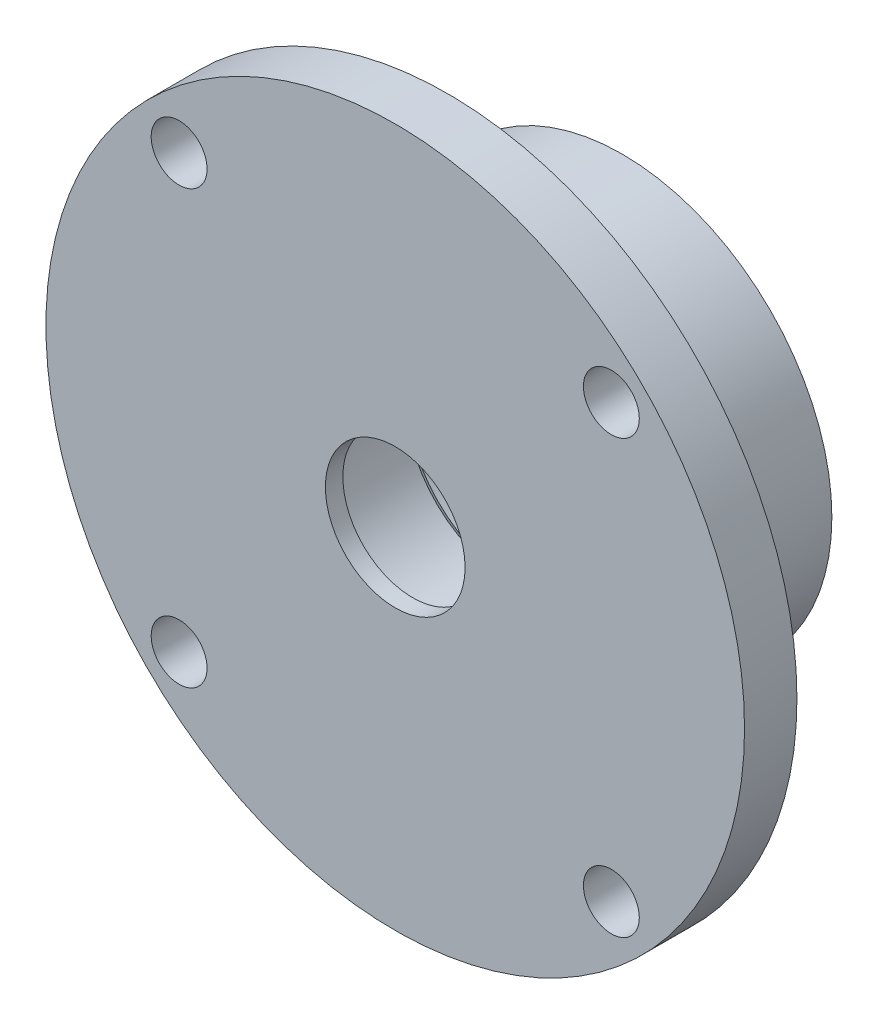
from build123d import *

# Parameters (mm, degrees)
CHAMFER_1_SIZE           = 0.4
CUT_EXTRUDE_1_REACH      = 33.129
SKETCH_2_R               = 1.6
PATTERN_CIRCULAR_1_COUNT = 4


with BuildPart() as part:
    # Эскиз1 → Повернуть1 (revolve)
    with BuildSketch(Plane(origin=(0, 0, 0), x_dir=(1, 0, 0), z_dir=(0, 1, 0))):
        Polygon((-4, 0), (-20, 0), (-20, 3), (-12, 3), (-12, 13), (-9.5, 13), (-9.5, 7), (-6, 7), (-6, 1), (-4, 1), align=None)
    revolve(axis=Axis((0, 0, 0), (0, 0, -1)))

    # Фаска1
    chamfer_1_edges = [part.edges().sort_by_distance(p)[0] for p in [
        (6, 0, -7),
    ]]
    chamfer(chamfer_1_edges, length=CHAMFER_1_SIZE)

    # Эскиз2 → Вырез-Вытянуть1 (cut, up to next)
    with BuildSketch(Plane.XY, mode=Mode.PRIVATE) as cut_extrude_1_sk1:
        with Locations((12.374368671, 12.374368671)):
            Circle(SKETCH_2_R)
    cut_extrude_1_tool1 = extrude(cut_extrude_1_sk1.sketch, amount=-CUT_EXTRUDE_1_REACH, mode=Mode.PRIVATE) & part.part
    cut_extrude_1 = cut_extrude_1_tool1.solids().sort_by_distance((12.374369, 12.374369, 0))[0]
    add(cut_extrude_1, mode=Mode.SUBTRACT)

    # Круговой массив1: Вырез-Вытянуть1 ×4 about axis
    pattern_circular_1_axis = Axis((0, 0, 0), (0, 0, 1))
    for i in range(1, PATTERN_CIRCULAR_1_COUNT):
        add(cut_extrude_1.rotate(pattern_circular_1_axis, i * 360 / PATTERN_CIRCULAR_1_COUNT), mode=Mode.SUBTRACT)


solid = part.part
